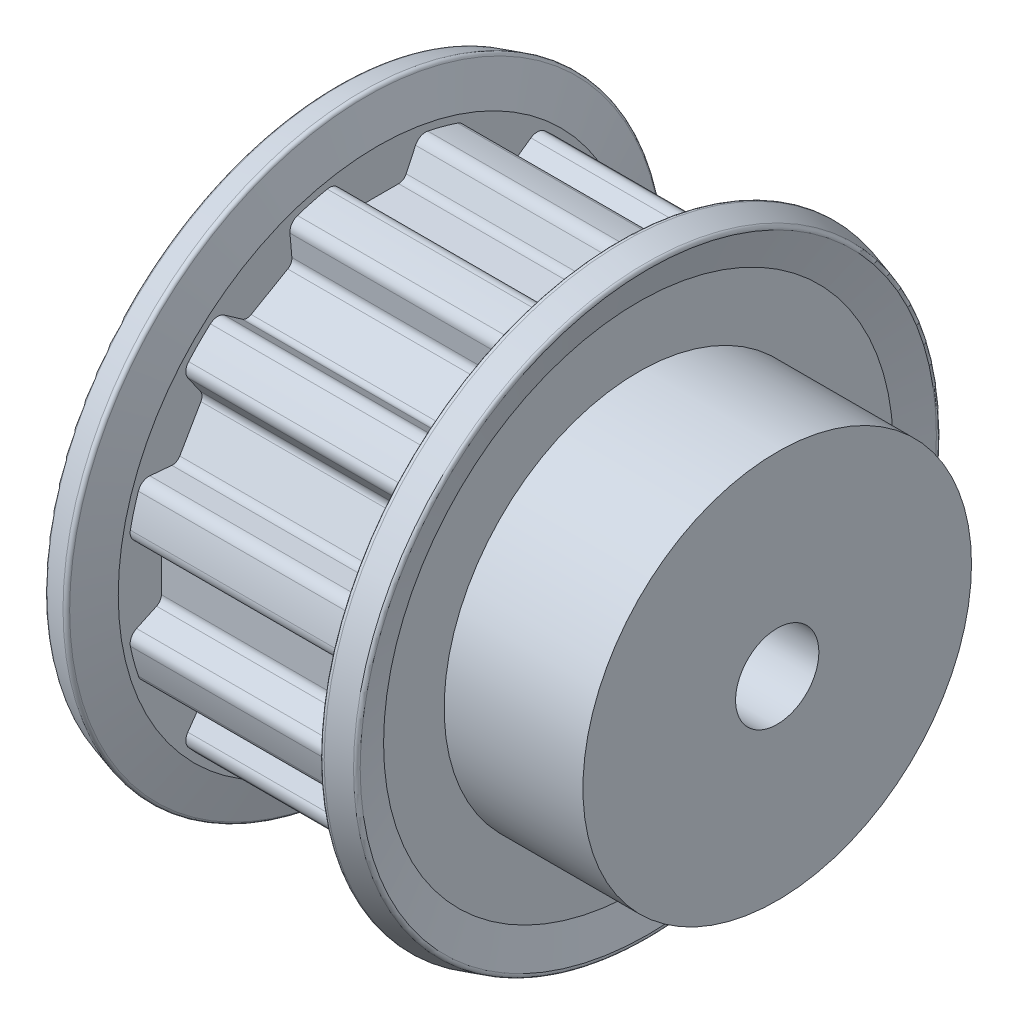
from build123d import *

# Parameters (mm, degrees)
WYTNIJ_WYCI_GNI_CIE1_DEPTH = 41.269855351
SZYK_KO_OWY1_COUNT         = 12
ZAOKR_GLENIE1_R            = 0.25
PODZIEL3_START             = -31
PODZIEL3_OUTLINE_R         = 13.5
PODZIEL3_DEPTH             = 2.2
PODZIEL4_START             = -12.2
PODZIEL4_OUTLINE_R         = 13.5
PODZIEL4_DEPTH             = 2.2


# Read off the part's stored shape, not the designer's step: Podziel3, Podziel4
with BuildPart() as part:
    # Szkic1 → 31 T10/12/2F (revolve)
    with BuildSketch(Plane.XY, mode=Mode.PRIVATE) as f_31_t10_12_2f_sk:
        Polygon((0, 3), (0, 14), (-10, 14), (-10, 18.175), (-31, 18.175), (-31, 3), align=None)
    revolve(f_31_t10_12_2f_sk.sketch.rotate(Axis((0, 0, 0), (-1, 0, 0)), 90), axis=Axis((0, 0, 0), (-1, 0, 0)))

    # Szkic2 → Wytnij-wyciągnięcie1 (cut, symmetric)
    with BuildSketch(Plane.ZY.offset(31)):
        with BuildLine():
            Line((-95.878294595, -0.955389606), (-3.622784307, 17.810279584))
            ThreePointArc((-3.622784307, 17.810279584), (-3.103228648, 17.740709099), (-2.738275769, 17.364427912))
            Line((-2.738275769, 17.364427912), (-2.065394346, 15.921429043))
            ThreePointArc((-2.065394346, 15.921429043), (-1.843989439, 15.668965133), (-1.521609673, 15.575))
            Line((-1.521609673, 15.575), (1.521609673, 15.575))
            ThreePointArc((1.521609673, 15.575), (1.843989439, 15.668965133), (2.065394346, 15.921429043))
            Line((2.065394346, 15.921429043), (2.738275769, 17.364427912))
            ThreePointArc((2.738275769, 17.364427912), (3.103228648, 17.740709099), (3.622784307, 17.810279584))
            Line((3.622784307, 17.810279584), (95.878294595, -0.955389606))
            Line((95.878294595, -0.955389606), (95.878294595, 187.334063298))
            Line((95.878294595, 187.334063298), (-95.878294595, 187.334063298))
            Line((-95.878294595, 187.334063298), (-95.878294595, -0.955389606))
        make_face()
    wytnij_wyci_gni_cie1 = extrude(amount=WYTNIJ_WYCI_GNI_CIE1_DEPTH, both=True, mode=Mode.SUBTRACT)

    # Szyk kołowy1: Wytnij-wyciągnięcie1 ×12 about axis
    szyk_ko_owy1_axis = Axis((0, 0, 0), (1, 0, 0))
    for i in range(1, SZYK_KO_OWY1_COUNT):
        add(wytnij_wyci_gni_cie1.rotate(szyk_ko_owy1_axis, i * 360 / SZYK_KO_OWY1_COUNT), mode=Mode.SUBTRACT)

    # Podziel3 outline → Podziel3 (cut)
    with BuildSketch(Plane.YZ.offset(PODZIEL3_START)):
        with BuildLine():
            ThreePointArc((11.053630335, -13.668897809), (11.557829392, -13.812290437), (12.042563034, -13.612762415))
            ThreePointArc((12.042563034, -13.612762415), (12.851665748, -12.851665748), (13.612762415, -12.042563034))
            ThreePointArc((13.612762415, -12.042563034), (13.812290437, -11.557829392), (13.668897809, -11.053630335))
            Line((13.668897809, -11.053630335), (12.755664843, -9.749398494))
            ThreePointArc((12.755664843, -9.749398494), (12.647727137, -9.431424265), (12.727540827, -9.105252632))
            Line((12.727540827, -9.105252632), (14.249150501, -6.469747368))
            ThreePointArc((14.249150501, -6.469747368), (14.491716575, -6.237540868), (14.821059189, -6.172030549))
            Line((14.821059189, -6.172030549), (16.407173579, -6.310797577))
            ThreePointArc((16.407173579, -6.310797577), (16.915519085, -6.182879707), (17.235546722, -5.76771655))
            ThreePointArc((17.235546722, -5.76771655), (17.555701893, -4.704036145), (17.810279584, -3.622784307))
            ThreePointArc((17.810279584, -3.622784307), (17.740709099, -3.103228648), (17.364427912, -2.738275769))
            Line((17.364427912, -2.738275769), (15.921429043, -2.065394346))
            ThreePointArc((15.921429043, -2.065394346), (15.668965133, -1.843989438), (15.575, -1.521609673))
            Line((15.575, -1.521609673), (15.575, 1.521609673))
            ThreePointArc((15.575, 1.521609673), (15.668965133, 1.843989438), (15.921429043, 2.065394346))
            Line((15.921429043, 2.065394346), (17.364427912, 2.738275769))
            ThreePointArc((17.364427912, 2.738275769), (17.740709099, 3.103228648), (17.810279584, 3.622784307))
            ThreePointArc((17.810279584, 3.622784307), (17.555701893, 4.704036145), (17.235546722, 5.76771655))
            ThreePointArc((17.235546722, 5.76771655), (16.915519085, 6.182879707), (16.407173579, 6.310797577))
            Line((16.407173579, 6.310797577), (14.821059189, 6.172030549))
            ThreePointArc((14.821059189, 6.172030549), (14.491716575, 6.237540868), (14.249150501, 6.469747368))
            Line((14.249150501, 6.469747368), (12.727540827, 9.105252632))
            ThreePointArc((12.727540827, 9.105252632), (12.647727137, 9.431424265), (12.755664843, 9.749398494))
            Line((12.755664843, 9.749398494), (13.668897809, 11.053630335))
            ThreePointArc((13.668897809, 11.053630335), (13.812290437, 11.557829392), (13.612762415, 12.042563034))
            ThreePointArc((13.612762415, 12.042563034), (12.851665748, 12.851665748), (12.042563034, 13.612762415))
            ThreePointArc((12.042563034, 13.612762415), (11.557829392, 13.812290437), (11.053630335, 13.668897809))
            Line((11.053630335, 13.668897809), (9.749398494, 12.755664843))
            ThreePointArc((9.749398494, 12.755664843), (9.431424265, 12.647727137), (9.105252632, 12.727540827))
            Line((9.105252632, 12.727540827), (6.469747368, 14.249150501))
            ThreePointArc((6.469747368, 14.249150501), (6.237540868, 14.491716575), (6.172030549, 14.821059189))
            Line((6.172030549, 14.821059189), (6.310797577, 16.407173579))
            ThreePointArc((6.310797577, 16.407173579), (6.182879707, 16.915519085), (5.76771655, 17.235546722))
            ThreePointArc((5.76771655, 17.235546722), (4.704036145, 17.555701893), (3.622784307, 17.810279584))
            ThreePointArc((3.622784307, 17.810279584), (3.103228648, 17.740709099), (2.738275769, 17.364427912))
            Line((2.738275769, 17.364427912), (2.065394346, 15.921429043))
            ThreePointArc((2.065394346, 15.921429043), (1.843989438, 15.668965133), (1.521609673, 15.575))
            Line((1.521609673, 15.575), (-1.521609673, 15.575))
            ThreePointArc((-1.521609673, 15.575), (-1.843989438, 15.668965133), (-2.065394346, 15.921429043))
            Line((-2.065394346, 15.921429043), (-2.738275769, 17.364427912))
            ThreePointArc((-2.738275769, 17.364427912), (-3.103228648, 17.740709099), (-3.622784307, 17.810279584))
            ThreePointArc((-3.622784307, 17.810279584), (-4.704036145, 17.555701893), (-5.76771655, 17.235546722))
            ThreePointArc((-5.76771655, 17.235546722), (-6.182879707, 16.915519085), (-6.310797577, 16.407173579))
            Line((-6.310797577, 16.407173579), (-6.172030549, 14.821059189))
            ThreePointArc((-6.172030549, 14.821059189), (-6.237540868, 14.491716575), (-6.469747368, 14.249150501))
            Line((-6.469747368, 14.249150501), (-9.105252632, 12.727540827))
            ThreePointArc((-9.105252632, 12.727540827), (-9.431424265, 12.647727137), (-9.749398494, 12.755664843))
            Line((-9.749398494, 12.755664843), (-11.053630335, 13.668897809))
            ThreePointArc((-11.053630335, 13.668897809), (-11.557829392, 13.812290437), (-12.042563034, 13.612762415))
            ThreePointArc((-12.042563034, 13.612762415), (-12.851665748, 12.851665748), (-13.612762415, 12.042563034))
            ThreePointArc((-13.612762415, 12.042563034), (-13.812290437, 11.557829392), (-13.668897809, 11.053630335))
            Line((-13.668897809, 11.053630335), (-12.755664843, 9.749398494))
            ThreePointArc((-12.755664843, 9.749398494), (-12.647727137, 9.431424265), (-12.727540827, 9.105252632))
            Line((-12.727540827, 9.105252632), (-14.249150501, 6.469747368))
            ThreePointArc((-14.249150501, 6.469747368), (-14.491716575, 6.237540868), (-14.821059189, 6.172030549))
            Line((-14.821059189, 6.172030549), (-16.407173579, 6.310797577))
            ThreePointArc((-16.407173579, 6.310797577), (-16.915519085, 6.182879707), (-17.235546722, 5.76771655))
            ThreePointArc((-17.235546722, 5.76771655), (-17.555701893, 4.704036145), (-17.810279584, 3.622784307))
            ThreePointArc((-17.810279584, 3.622784307), (-17.740709099, 3.103228648), (-17.364427912, 2.738275769))
            Line((-17.364427912, 2.738275769), (-15.921429043, 2.065394346))
            ThreePointArc((-15.921429043, 2.065394346), (-15.668965133, 1.843989438), (-15.575, 1.521609673))
            Line((-15.575, 1.521609673), (-15.575, -1.521609673))
            ThreePointArc((-15.575, -1.521609673), (-15.668965133, -1.843989438), (-15.921429043, -2.065394346))
            Line((-15.921429043, -2.065394346), (-17.364427912, -2.738275769))
            ThreePointArc((-17.364427912, -2.738275769), (-17.740709099, -3.103228648), (-17.810279584, -3.622784307))
            ThreePointArc((-17.810279584, -3.622784307), (-17.555701893, -4.704036145), (-17.235546722, -5.76771655))
            ThreePointArc((-17.235546722, -5.76771655), (-16.915519085, -6.182879707), (-16.407173579, -6.310797577))
            Line((-16.407173579, -6.310797577), (-14.821059189, -6.172030549))
            ThreePointArc((-14.821059189, -6.172030549), (-14.491716575, -6.237540868), (-14.249150501, -6.469747368))
            Line((-14.249150501, -6.469747368), (-12.727540827, -9.105252632))
            ThreePointArc((-12.727540827, -9.105252632), (-12.647727137, -9.431424265), (-12.755664843, -9.749398494))
            Line((-12.755664843, -9.749398494), (-13.668897809, -11.053630335))
            ThreePointArc((-13.668897809, -11.053630335), (-13.812290437, -11.557829392), (-13.612762415, -12.042563034))
            ThreePointArc((-13.612762415, -12.042563034), (-12.851665748, -12.851665748), (-12.042563034, -13.612762415))
            ThreePointArc((-12.042563034, -13.612762415), (-11.557829392, -13.812290437), (-11.053630335, -13.668897809))
            Line((-11.053630335, -13.668897809), (-9.749398494, -12.755664843))
            ThreePointArc((-9.749398494, -12.755664843), (-9.431424265, -12.647727137), (-9.105252632, -12.727540827))
            Line((-9.105252632, -12.727540827), (-6.469747368, -14.249150501))
            ThreePointArc((-6.469747368, -14.249150501), (-6.237540868, -14.491716575), (-6.172030549, -14.821059189))
            Line((-6.172030549, -14.821059189), (-6.310797577, -16.407173579))
            ThreePointArc((-6.310797577, -16.407173579), (-6.182879707, -16.915519085), (-5.76771655, -17.235546722))
            ThreePointArc((-5.76771655, -17.235546722), (-4.704036145, -17.555701893), (-3.622784307, -17.810279584))
            ThreePointArc((-3.622784307, -17.810279584), (-3.103228648, -17.740709099), (-2.738275769, -17.364427912))
            Line((-2.738275769, -17.364427912), (-2.065394346, -15.921429043))
            ThreePointArc((-2.065394346, -15.921429043), (-1.843989438, -15.668965133), (-1.521609673, -15.575))
            Line((-1.521609673, -15.575), (1.521609673, -15.575))
            ThreePointArc((1.521609673, -15.575), (1.843989438, -15.668965133), (2.065394346, -15.921429043))
            Line((2.065394346, -15.921429043), (2.738275769, -17.364427912))
            ThreePointArc((2.738275769, -17.364427912), (3.103228648, -17.740709099), (3.622784307, -17.810279584))
            ThreePointArc((3.622784307, -17.810279584), (4.704036145, -17.555701893), (5.76771655, -17.235546722))
            ThreePointArc((5.76771655, -17.235546722), (6.182879707, -16.915519085), (6.310797577, -16.407173579))
            Line((6.310797577, -16.407173579), (6.172030549, -14.821059189))
            ThreePointArc((6.172030549, -14.821059189), (6.237540868, -14.491716575), (6.469747368, -14.249150501))
            Line((6.469747368, -14.249150501), (9.105252632, -12.727540827))
            ThreePointArc((9.105252632, -12.727540827), (9.431424265, -12.647727137), (9.749398494, -12.755664843))
            Line((9.749398494, -12.755664843), (11.053630335, -13.668897809))
        make_face()
        Circle(PODZIEL3_OUTLINE_R, mode=Mode.SUBTRACT)
    extrude(amount=PODZIEL3_DEPTH, mode=Mode.SUBTRACT)

    # Podziel4 outline → Podziel4 (cut)
    with BuildSketch(Plane.YZ.offset(PODZIEL4_START)):
        with BuildLine():
            ThreePointArc((17.235546722, -5.76771655), (17.555701893, -4.704036145), (17.810279584, -3.622784307))
            ThreePointArc((17.810279584, -3.622784307), (17.740709099, -3.103228648), (17.364427912, -2.738275769))
            Line((17.364427912, -2.738275769), (15.921429043, -2.065394346))
            ThreePointArc((15.921429043, -2.065394346), (15.668965133, -1.843989438), (15.575, -1.521609673))
            Line((15.575, -1.521609673), (15.575, 1.521609673))
            ThreePointArc((15.575, 1.521609673), (15.668965133, 1.843989438), (15.921429043, 2.065394346))
            Line((15.921429043, 2.065394346), (17.364427912, 2.738275769))
            ThreePointArc((17.364427912, 2.738275769), (17.740709099, 3.103228648), (17.810279584, 3.622784307))
            ThreePointArc((17.810279584, 3.622784307), (17.555701893, 4.704036145), (17.235546722, 5.76771655))
            ThreePointArc((17.235546722, 5.76771655), (16.915519085, 6.182879707), (16.407173579, 6.310797577))
            Line((16.407173579, 6.310797577), (14.821059189, 6.172030549))
            ThreePointArc((14.821059189, 6.172030549), (14.491716575, 6.237540868), (14.249150501, 6.469747368))
            Line((14.249150501, 6.469747368), (12.727540827, 9.105252632))
            ThreePointArc((12.727540827, 9.105252632), (12.647727137, 9.431424265), (12.755664843, 9.749398494))
            Line((12.755664843, 9.749398494), (13.668897809, 11.053630335))
            ThreePointArc((13.668897809, 11.053630335), (13.812290437, 11.557829392), (13.612762415, 12.042563034))
            ThreePointArc((13.612762415, 12.042563034), (12.851665748, 12.851665748), (12.042563034, 13.612762415))
            ThreePointArc((12.042563034, 13.612762415), (11.557829392, 13.812290437), (11.053630335, 13.668897809))
            Line((11.053630335, 13.668897809), (9.749398494, 12.755664843))
            ThreePointArc((9.749398494, 12.755664843), (9.431424265, 12.647727137), (9.105252632, 12.727540827))
            Line((9.105252632, 12.727540827), (6.469747368, 14.249150501))
            ThreePointArc((6.469747368, 14.249150501), (6.237540868, 14.491716575), (6.172030549, 14.821059189))
            Line((6.172030549, 14.821059189), (6.310797577, 16.407173579))
            ThreePointArc((6.310797577, 16.407173579), (6.182879707, 16.915519085), (5.76771655, 17.235546722))
            ThreePointArc((5.76771655, 17.235546722), (4.704036145, 17.555701893), (3.622784307, 17.810279584))
            ThreePointArc((3.622784307, 17.810279584), (3.103228648, 17.740709099), (2.738275769, 17.364427912))
            Line((2.738275769, 17.364427912), (2.065394346, 15.921429043))
            ThreePointArc((2.065394346, 15.921429043), (1.843989438, 15.668965133), (1.521609673, 15.575))
            Line((1.521609673, 15.575), (-1.521609673, 15.575))
            ThreePointArc((-1.521609673, 15.575), (-1.843989438, 15.668965133), (-2.065394346, 15.921429043))
            Line((-2.065394346, 15.921429043), (-2.738275769, 17.364427912))
            ThreePointArc((-2.738275769, 17.364427912), (-3.103228648, 17.740709099), (-3.622784307, 17.810279584))
            ThreePointArc((-3.622784307, 17.810279584), (-4.704036145, 17.555701893), (-5.76771655, 17.235546722))
            ThreePointArc((-5.76771655, 17.235546722), (-6.182879707, 16.915519085), (-6.310797577, 16.407173579))
            Line((-6.310797577, 16.407173579), (-6.172030549, 14.821059189))
            ThreePointArc((-6.172030549, 14.821059189), (-6.237540868, 14.491716575), (-6.469747368, 14.249150501))
            Line((-6.469747368, 14.249150501), (-9.105252632, 12.727540827))
            ThreePointArc((-9.105252632, 12.727540827), (-9.431424265, 12.647727137), (-9.749398494, 12.755664843))
            Line((-9.749398494, 12.755664843), (-11.053630335, 13.668897809))
            ThreePointArc((-11.053630335, 13.668897809), (-11.557829392, 13.812290437), (-12.042563034, 13.612762415))
            ThreePointArc((-12.042563034, 13.612762415), (-12.851665748, 12.851665748), (-13.612762415, 12.042563034))
            ThreePointArc((-13.612762415, 12.042563034), (-13.812290437, 11.557829392), (-13.668897809, 11.053630335))
            Line((-13.668897809, 11.053630335), (-12.755664843, 9.749398494))
            ThreePointArc((-12.755664843, 9.749398494), (-12.647727137, 9.431424265), (-12.727540827, 9.105252632))
            Line((-12.727540827, 9.105252632), (-14.249150501, 6.469747368))
            ThreePointArc((-14.249150501, 6.469747368), (-14.491716575, 6.237540868), (-14.821059189, 6.172030549))
            Line((-14.821059189, 6.172030549), (-16.407173579, 6.310797577))
            ThreePointArc((-16.407173579, 6.310797577), (-16.915519085, 6.182879707), (-17.235546722, 5.76771655))
            ThreePointArc((-17.235546722, 5.76771655), (-17.555701893, 4.704036145), (-17.810279584, 3.622784307))
            ThreePointArc((-17.810279584, 3.622784307), (-17.740709099, 3.103228648), (-17.364427912, 2.738275769))
            Line((-17.364427912, 2.738275769), (-15.921429043, 2.065394346))
            ThreePointArc((-15.921429043, 2.065394346), (-15.668965133, 1.843989438), (-15.575, 1.521609673))
            Line((-15.575, 1.521609673), (-15.575, -1.521609673))
            ThreePointArc((-15.575, -1.521609673), (-15.668965133, -1.843989438), (-15.921429043, -2.065394346))
            Line((-15.921429043, -2.065394346), (-17.364427912, -2.738275769))
            ThreePointArc((-17.364427912, -2.738275769), (-17.740709099, -3.103228648), (-17.810279584, -3.622784307))
            ThreePointArc((-17.810279584, -3.622784307), (-17.555701893, -4.704036145), (-17.235546722, -5.76771655))
            ThreePointArc((-17.235546722, -5.76771655), (-16.915519085, -6.182879707), (-16.407173579, -6.310797577))
            Line((-16.407173579, -6.310797577), (-14.821059189, -6.172030549))
            ThreePointArc((-14.821059189, -6.172030549), (-14.491716575, -6.237540868), (-14.249150501, -6.469747368))
            Line((-14.249150501, -6.469747368), (-12.727540827, -9.105252632))
            ThreePointArc((-12.727540827, -9.105252632), (-12.647727137, -9.431424265), (-12.755664843, -9.749398494))
            Line((-12.755664843, -9.749398494), (-13.668897809, -11.053630335))
            ThreePointArc((-13.668897809, -11.053630335), (-13.812290437, -11.557829392), (-13.612762415, -12.042563034))
            ThreePointArc((-13.612762415, -12.042563034), (-12.851665748, -12.851665748), (-12.042563034, -13.612762415))
            ThreePointArc((-12.042563034, -13.612762415), (-11.557829392, -13.812290437), (-11.053630335, -13.668897809))
            Line((-11.053630335, -13.668897809), (-9.749398494, -12.755664843))
            ThreePointArc((-9.749398494, -12.755664843), (-9.431424265, -12.647727137), (-9.105252632, -12.727540827))
            Line((-9.105252632, -12.727540827), (-6.469747368, -14.249150501))
            ThreePointArc((-6.469747368, -14.249150501), (-6.237540868, -14.491716575), (-6.172030549, -14.821059189))
            Line((-6.172030549, -14.821059189), (-6.310797577, -16.407173579))
            ThreePointArc((-6.310797577, -16.407173579), (-6.182879707, -16.915519085), (-5.76771655, -17.235546722))
            ThreePointArc((-5.76771655, -17.235546722), (-4.704036145, -17.555701893), (-3.622784307, -17.810279584))
            ThreePointArc((-3.622784307, -17.810279584), (-3.103228648, -17.740709099), (-2.738275769, -17.364427912))
            Line((-2.738275769, -17.364427912), (-2.065394346, -15.921429043))
            ThreePointArc((-2.065394346, -15.921429043), (-1.843989438, -15.668965133), (-1.521609673, -15.575))
            Line((-1.521609673, -15.575), (1.521609673, -15.575))
            ThreePointArc((1.521609673, -15.575), (1.843989438, -15.668965133), (2.065394346, -15.921429043))
            Line((2.065394346, -15.921429043), (2.738275769, -17.364427912))
            ThreePointArc((2.738275769, -17.364427912), (3.103228648, -17.740709099), (3.622784307, -17.810279584))
            ThreePointArc((3.622784307, -17.810279584), (4.704036145, -17.555701893), (5.76771655, -17.235546722))
            ThreePointArc((5.76771655, -17.235546722), (6.182879707, -16.915519085), (6.310797577, -16.407173579))
            Line((6.310797577, -16.407173579), (6.172030549, -14.821059189))
            ThreePointArc((6.172030549, -14.821059189), (6.237540868, -14.491716575), (6.469747368, -14.249150501))
            Line((6.469747368, -14.249150501), (9.105252632, -12.727540827))
            ThreePointArc((9.105252632, -12.727540827), (9.431424265, -12.647727137), (9.749398494, -12.755664843))
            Line((9.749398494, -12.755664843), (11.053630335, -13.668897809))
            ThreePointArc((11.053630335, -13.668897809), (11.557829392, -13.812290437), (12.042563034, -13.612762415))
            ThreePointArc((12.042563034, -13.612762415), (12.851665748, -12.851665748), (13.612762415, -12.042563034))
            ThreePointArc((13.612762415, -12.042563034), (13.812290437, -11.557829392), (13.668897809, -11.053630335))
            Line((13.668897809, -11.053630335), (12.755664843, -9.749398494))
            ThreePointArc((12.755664843, -9.749398494), (12.647727137, -9.431424265), (12.727540827, -9.105252632))
            Line((12.727540827, -9.105252632), (14.249150501, -6.469747368))
            ThreePointArc((14.249150501, -6.469747368), (14.491716575, -6.237540868), (14.821059189, -6.172030549))
            Line((14.821059189, -6.172030549), (16.407173579, -6.310797577))
            ThreePointArc((16.407173579, -6.310797577), (16.915519085, -6.182879707), (17.235546722, -5.76771655))
        make_face()
        Circle(PODZIEL4_OUTLINE_R, mode=Mode.SUBTRACT)
    extrude(amount=PODZIEL4_DEPTH, mode=Mode.SUBTRACT)


with BuildPart() as body_2:
    # Szkic3 → Obrót-cienka ścianka1 (revolve)
    with BuildSketch(Plane.XY, mode=Mode.PRIVATE) as obr_t_cienka_cianka1_sk:
        Polygon((-31, 13.5), (-31, 18.365), (-31.780522559, 21), (-29.671119143, 21.624833758), (-28.8, 18.683984819), (-28.8, 13.5), align=None)
    revolve(obr_t_cienka_cianka1_sk.sketch.rotate(Axis((0, 0, 0), (1, 0, 0)), 90), axis=Axis((0, 0, 0), (1, 0, 0)))

    # Zaokrąglenie1
    zaokr_glenie1_edges = [body_2.edges().sort_by_distance(p)[0] for p in [
        (-29.671119143, 0, -21.624833758),
        (-31.780522559, 0, -21),
    ]]
    fillet(zaokr_glenie1_edges, radius=ZAOKR_GLENIE1_R)


with BuildPart() as body_3:
    # Lustro1: mirrored copy
    add(body_2.part.mirror(Plane.ZY.offset(20.5)))


solid = Compound([part.part, body_2.part, body_3.part])
